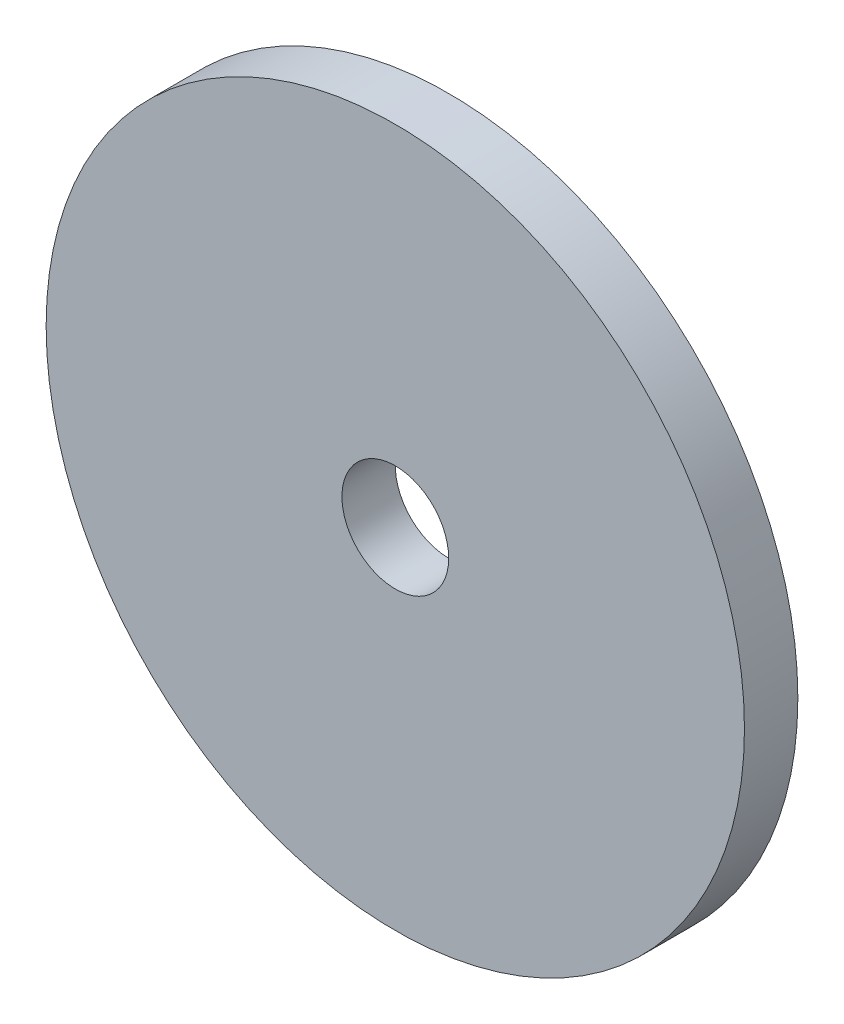
from build123d import *

# Parameters (mm, degrees)
SKETCH1_R           = 41.529
SKETCH1_R_2         = 6.35
BOSS_EXTRUDE1_DEPTH = 6.35


with BuildPart() as part:
    # Sketch1 → Boss-Extrude1 (new body)
    with BuildSketch(Plane.XY):
        Circle(SKETCH1_R)
        Circle(SKETCH1_R_2, mode=Mode.SUBTRACT)
    extrude(amount=BOSS_EXTRUDE1_DEPTH)


solid = part.part
